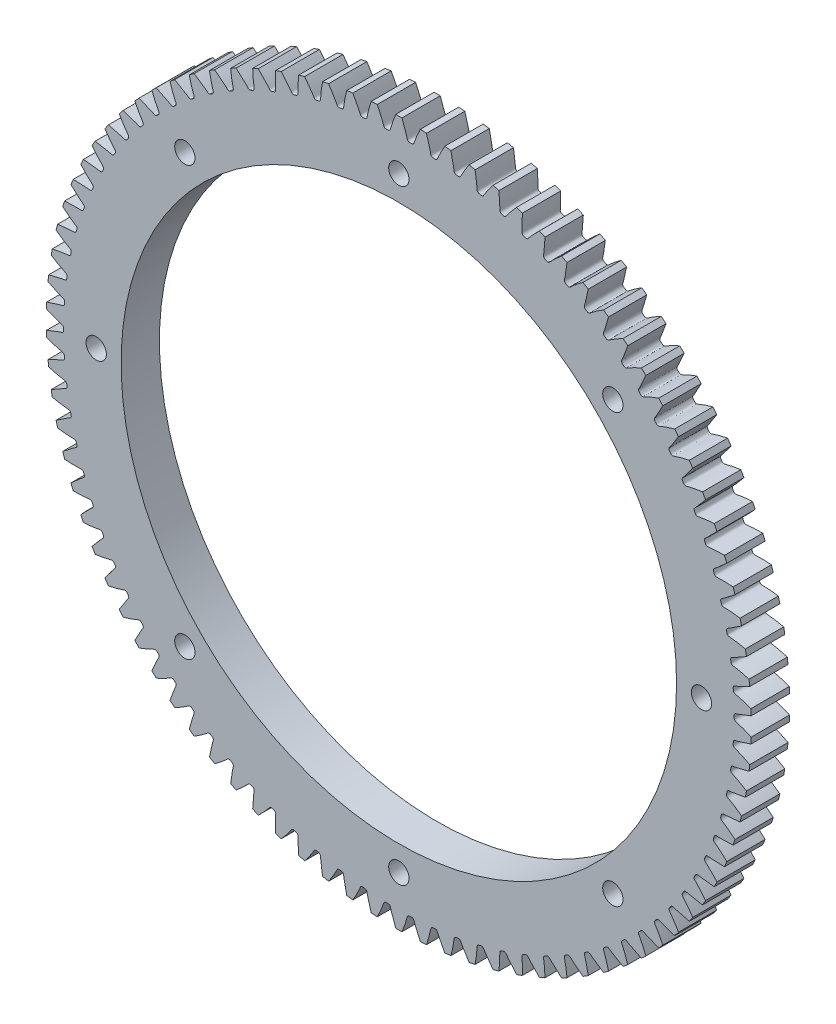
from build123d import *

# Parameters (mm, degrees)
SKETCHREVOLVESPURGEAR2_W       = 10
SKETCHREVOLVESPURGEAR2_H       = 92
TOOTHEXTRUDECUTSPURGEAR2_DEPTH = 5
PATTERNSPURGEAR2_COUNT         = 90
BOREREVOLVESKETCH_W            = 10
BOREREVOLVESKETCH_H            = 5
SKETCH_5_R                     = 72.5
SKETCH_5_R_2                   = 2.65
CUT_EXTRUDE_3_DEPTH            = 10


with BuildPart() as part:
    # SketchRevolveSpurGear2 → SpurGear2 (revolve)
    with BuildSketch(Plane(origin=(0, 0, 0), x_dir=(0, 0, -1), z_dir=(1, 0, 0))):
        with Locations((0, 46)):
            Rectangle(SKETCHREVOLVESPURGEAR2_W, SKETCHREVOLVESPURGEAR2_H)
    revolve(axis=Axis((0, 0, 0), (0, 0, -1)))

    # SketchToothSpurGear2 → ToothExtrudeCutSpurGear2 (cut, symmetric)
    with BuildSketch(Plane.XY):
        with BuildLine():
            ThreePointArc((91.968490936, 2.407628489), (92, 0), (91.968490936, -2.407628489))
            add(Edge.make_bspline(
                [(91.968490936, -2.407628489), (91.73835055, -2.301870549), (91.432671386, -2.165258983), (91.051472911, -2.00153044), (90.830077509, -1.908314336), (90.612042659, -1.818348935), (90.397403415, -1.731581159), (90.186194224, -1.647957566), (89.978448941, -1.56742441), (89.77420084, -1.489927555), (89.573482535, -1.415412782), (89.376326276, -1.343824723), (89.182762841, -1.275110739), (88.992825537, -1.209206918), (88.806535747, -1.146088701), (88.623955079, -1.085588105), (88.444997201, -1.028053276), (88.211944292, -0.953319388), (88.00549752, -0.89754798), (87.832049781, -0.833366388), (87.75001906, -0.783530429), (87.676573889, -0.722076462), (87.613906773, -0.649553308), (87.563457398, -0.5680655), (87.526748882, -0.479599463), (87.503867082, -0.386421857), (87.497579307, -0.27415184), (87.500596008, -0.145452765), (87.499701996, 0), (87.500596008, 0.145452765), (87.497579307, 0.27415184), (87.503867082, 0.386421857), (87.526748882, 0.479599463), (87.563457398, 0.5680655), (87.613906773, 0.649553308), (87.676573889, 0.722076462), (87.75001906, 0.783530429), (87.832049781, 0.833366388), (88.00549752, 0.89754798), (88.211944292, 0.953319388), (88.444997201, 1.028053276), (88.623955079, 1.085588105), (88.806535747, 1.146088701), (88.992825537, 1.209206918), (89.182762841, 1.275110739), (89.376326276, 1.343824723), (89.573482535, 1.415412782), (89.77420084, 1.489927555), (89.978448941, 1.56742441), (90.186194224, 1.647957566), (90.397403415, 1.731581159), (90.612042659, 1.818348935), (90.830077509, 1.908314336), (91.051472911, 2.00153044), (91.432671386, 2.165258983), (91.73835055, 2.301870549), (91.968490936, 2.407628489)],
                knots=[0, 0, 0, 0, 0.070508965, 0.093204248, 0.115495628, 0.137383104, 0.158866678, 0.179946348, 0.200622114, 0.220893977, 0.240761937, 0.260225994, 0.279286147, 0.297942397, 0.316194743, 0.334043187, 0.351487727, 0.368528363, 0.402166275, 0.411021453, 0.41987663, 0.428731808, 0.437586986, 0.446442163, 0.455297341, 0.464152519, 0.473007697, 0.486503867, 0.5, 0.513496133, 0.526992303, 0.535847481, 0.544702659, 0.553557837, 0.562413014, 0.571268192, 0.58012337, 0.588978547, 0.597833725, 0.631471637, 0.648512273, 0.665956813, 0.683805257, 0.702057603, 0.720713853, 0.739774006, 0.759238063, 0.779106023, 0.799377886, 0.820053652, 0.841133322, 0.862616896, 0.884504372, 0.906795752, 0.929491035, 1, 1, 1, 1], degree=3))
        make_face()
    toothextrudecutspurgear2 = extrude(amount=TOOTHEXTRUDECUTSPURGEAR2_DEPTH, both=True, mode=Mode.SUBTRACT)

    # PatternSpurGear2: ToothExtrudeCutSpurGear2 ×90 about axis
    patternspurgear2_axis = Axis((0, 0, 55), (0, 0, -1))
    for i in range(1, PATTERNSPURGEAR2_COUNT):
        add(toothextrudecutspurgear2.rotate(patternspurgear2_axis, i * 360 / PATTERNSPURGEAR2_COUNT), mode=Mode.SUBTRACT)

    # BoreRevolveSketch → BoreRevolveCut (revolve, cut)
    with BuildSketch(Plane(origin=(0, 0, 0), x_dir=(0, 0, -1), z_dir=(1, 0, 0))):
        with Locations((0, 2.5)):
            Rectangle(BOREREVOLVESKETCH_W, BOREREVOLVESKETCH_H)
    revolve(axis=Axis((0, 0, 0), (0, 0, -1)), mode=Mode.SUBTRACT)

    # 草图5 → 切除-拉伸3 (cut)
    with BuildSketch(Plane.XY.offset(5)):
        Circle(SKETCH_5_R)
        with Locations((0, 79)):
            Circle(SKETCH_5_R_2)
        with Locations((55.861435714, 55.861435714)):
            Circle(SKETCH_5_R_2)
        with Locations((79, 0)):
            Circle(SKETCH_5_R_2)
        with Locations((55.861435714, -55.861435714)):
            Circle(SKETCH_5_R_2)
        with Locations((0, -79)):
            Circle(SKETCH_5_R_2)
        with Locations((-55.861435714, -55.861435714)):
            Circle(SKETCH_5_R_2)
        with Locations((-79, 0)):
            Circle(SKETCH_5_R_2)
        with Locations((-55.861435714, 55.861435714)):
            Circle(SKETCH_5_R_2)
    extrude(amount=-CUT_EXTRUDE_3_DEPTH, mode=Mode.SUBTRACT)


solid = part.part
